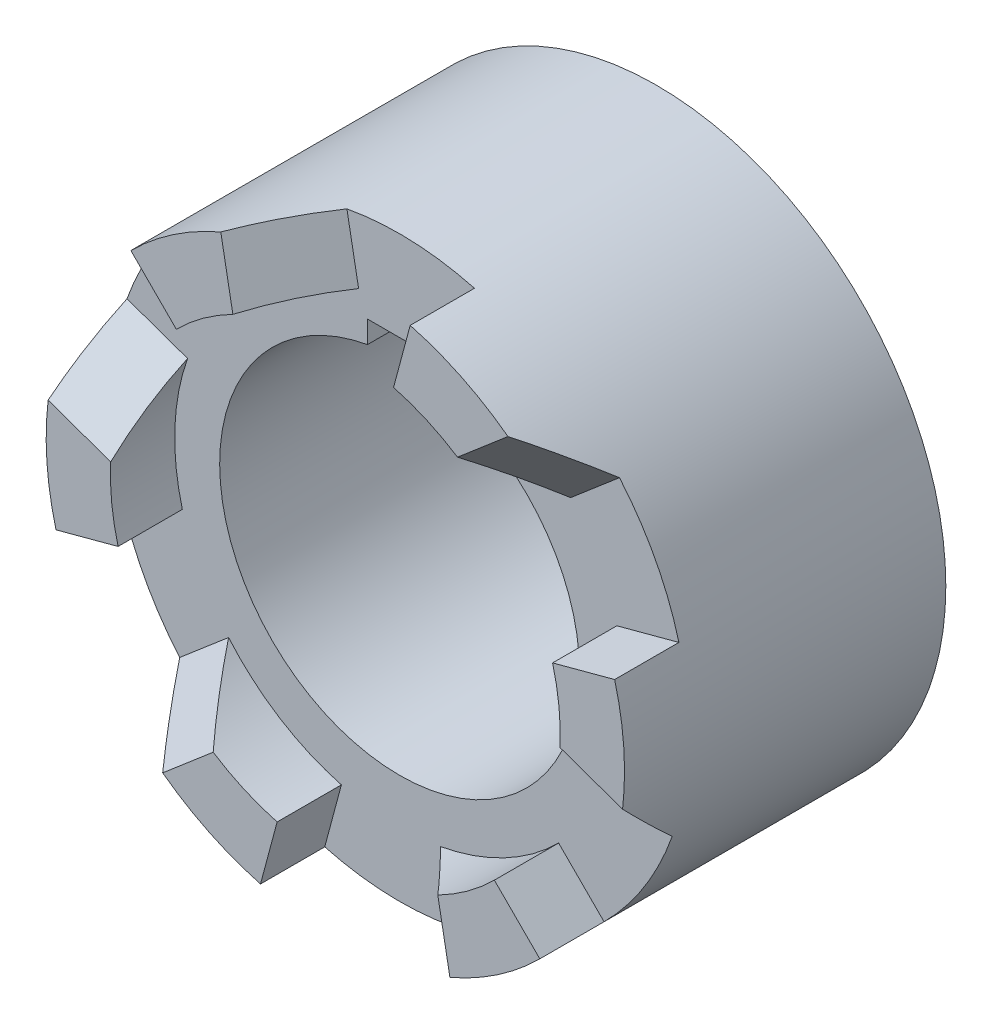
from build123d import *

# Parameters (mm, degrees)
SKETCH1_R                    = 22.5
BOSS_EXTRUDE1_DEPTH          = 20
BOSS_EXTRUDE2_DEPTH          = 5
CHAMFER2_SIZE                = 5
CIRPATTERN1_COUNT            = 6
CHAMFER2_OF_CIRPATTERN1_SIZE = 5
CIRPATTERN2_COUNT            = 4


with BuildPart() as part:
    # Sketch1 → Boss-Extrude1 (new body)
    with BuildSketch(Plane.XY):
        Circle(SKETCH1_R)
        with BuildLine():
            Line((2.5, 15.5), (-2.5, 15.5))
            Line((-2.5, 15.5), (-2.5, 13.774977314))
            ThreePointArc((-2.5, 13.774977314), (0, -14), (2.5, 13.774977314))
            Line((2.5, 13.774977314), (2.5, 15.5))
        make_face(mode=Mode.SUBTRACT)
    extrude(amount=BOSS_EXTRUDE1_DEPTH)

    # Sketch2 → Boss-Extrude2 (add)
    with BuildSketch(Plane.XY.offset(20)):
        with BuildLine():
            Line((-3.189121696, 17.206960882), (-4.100299324, 22.12323542))
            ThreePointArc((-4.100299324, 22.12323542), (-10.476326707, 19.912221843), (-15.909902577, 15.909902577))
            Line((-15.909902577, 15.909902577), (-12.374368671, 12.374368671))
            ThreePointArc((-12.374368671, 12.374368671), (-8.148254106, 15.487283656), (-3.189121696, 17.206960882))
        make_face()
    boss_extrude2 = extrude(amount=BOSS_EXTRUDE2_DEPTH)

    # Chamfer2
    chamfer2_edges = [part.edges().sort_by_distance(p)[0] for p in [
        (-3.64471051, 19.665098151, 25),
    ]]
    chamfer(chamfer2_edges, length=CHAMFER2_SIZE - 0.0001)  # a hair under: the kernel refuses the full size

    # CirPattern1: Boss-Extrude2 ×6 about axis
    cirpattern1_axis = Axis((0, 0, 0), (0, 0, 1))
    for i in range(1, CIRPATTERN1_COUNT):
        add(boss_extrude2.rotate(cirpattern1_axis, i * 360 / CIRPATTERN1_COUNT))

    # Chamfer2 of CirPattern1
    chamfer2_of_cirpattern1_edges = [part.edges().sort_by_distance(p)[0] for p in [
        (-18.852829822, 6.676137185, 25),
        (-15.208119312, -12.988960967, 25),
        (3.64471051, -19.665098151, 25),
        (18.852829822, -6.676137185, 25),
        (15.208119312, 12.988960967, 25),
    ]]
    chamfer(chamfer2_of_cirpattern1_edges, length=CHAMFER2_OF_CIRPATTERN1_SIZE - 0.0001)  # a hair under: the kernel refuses the full size

    # Sketch4 → M4 Tapped Hole1 (revolve, cut)
    with BuildSketch(Plane(origin=(0, 19, 0), x_dir=(0, 1, 0), z_dir=(1, 0, 0))):
        Polygon((0, 0), (0, 12.491420021), (1.65, 11.5), (1.65, 0), align=None)
    m4_tapped_hole1 = revolve(axis=Axis((0, 19, -6.35), (0, 0, 1)), mode=Mode.SUBTRACT)

    # CirPattern2: M4 Tapped Hole1 ×4 about axis
    cirpattern2_axis = Axis((0, 0, 0), (0, 0, 1))
    for i in range(1, CIRPATTERN2_COUNT):
        add(m4_tapped_hole1.rotate(cirpattern2_axis, i * 360 / CIRPATTERN2_COUNT), mode=Mode.SUBTRACT)


solid = part.part
